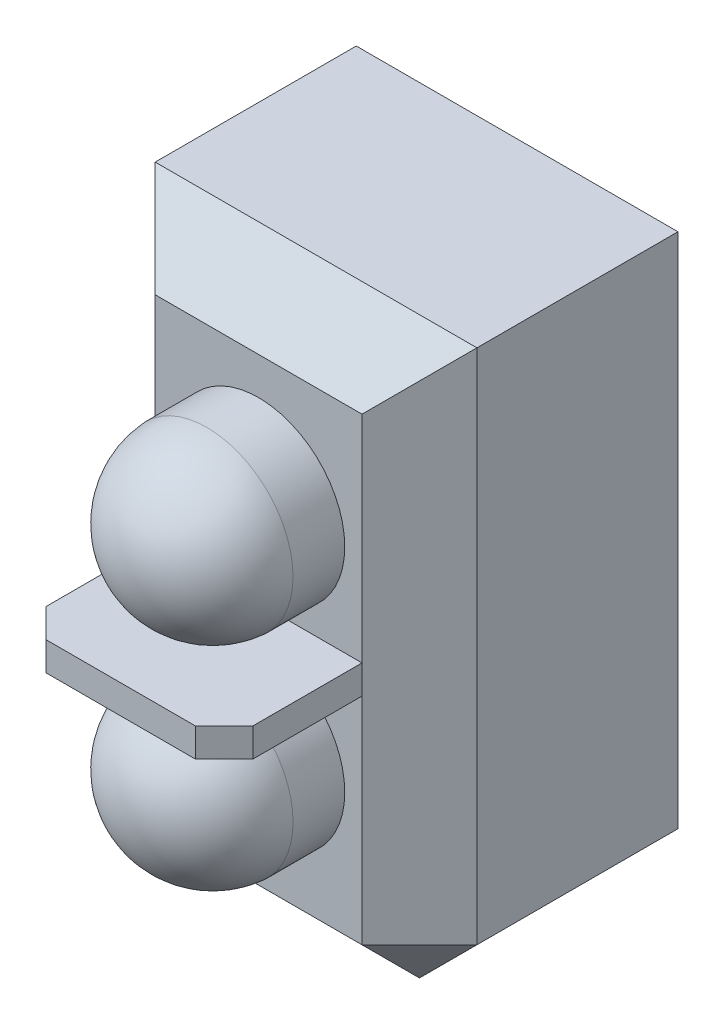
from build123d import *

# Parameters (mm, degrees)
SKETCH1_W           = 5.6
SKETCH1_H           = 10
BOSS_EXTRUDE1_DEPTH = 4.5
CHAMFER1_SIZE       = 1
SKETCH2_R           = 1.5
BOSS_EXTRUDE2_DEPTH = 0.9
SKETCH3_W           = 3.6
SKETCH3_H           = 0.5
BOSS_EXTRUDE3_DEPTH = 2.4
CHAMFER2_SIZE       = 0.5


# Read off the part's stored shape, not the designer's step: Dome1, Dome2
with BuildPart() as part:
    # Sketch1 → Boss-Extrude1 (new body)
    with BuildSketch(Plane.XY):
        Rectangle(SKETCH1_W, SKETCH1_H)
    extrude(amount=BOSS_EXTRUDE1_DEPTH)

    # Chamfer1
    chamfer1_edges = [part.edges().sort_by_distance(p)[0] for p in [
        (-2.8, 0, 4.5),
        (0, -5, 4.5),
        (2.8, 0, 4.5),
        (0, 5, 4.5),
        (2.8, -5, 2.25),
        (-2.8, -5, 2.25),
    ]]
    chamfer(chamfer1_edges, length=CHAMFER1_SIZE)

    # Sketch2 → Boss-Extrude2 (add)
    with BuildSketch(Plane.XY.offset(4.5)):
        with Locations((0, 1.85)):
            Circle(SKETCH2_R)
        with Locations((0, -1.85)):
            Circle(SKETCH2_R)
    extrude(amount=BOSS_EXTRUDE2_DEPTH)

    # Dome1 outline → Dome1 (revolve)
    with BuildSketch(Plane.XZ.offset(-1.85)):
        with BuildLine():
            Line((0, 5.4), (1.5, 5.399999999))
            ThreePointArc((1.5, 5.399999999), (1.025914227, 6.395622385), (0, 6.8))
            Line((0, 6.8), (0, 5.4))
        make_face()
    revolve(axis=Axis((0, 1.85, 0), (0, 0, 1)))

    # Dome2 outline → Dome2 (revolve)
    with BuildSketch(Plane.XZ.offset(1.85)):
        with BuildLine():
            Line((0, 5.4), (1.5, 5.399999999))
            ThreePointArc((1.5, 5.399999999), (1.025914227, 6.395622385), (0, 6.8))
            Line((0, 6.8), (0, 5.4))
        make_face()
    revolve(axis=Axis((0, -1.85, 0), (0, 0, 1)))

    # Sketch3 → Boss-Extrude3 (add)
    with BuildSketch(Plane.XY.offset(4.5)):
        Rectangle(SKETCH3_W, SKETCH3_H)
    extrude(amount=BOSS_EXTRUDE3_DEPTH)

    # Chamfer2
    chamfer2_edges = [part.edges().sort_by_distance(p)[0] for p in [
        (1.8, 0, 6.9),
        (-1.8, 0, 6.9),
    ]]
    chamfer(chamfer2_edges, length=CHAMFER2_SIZE)


solid = part.part
